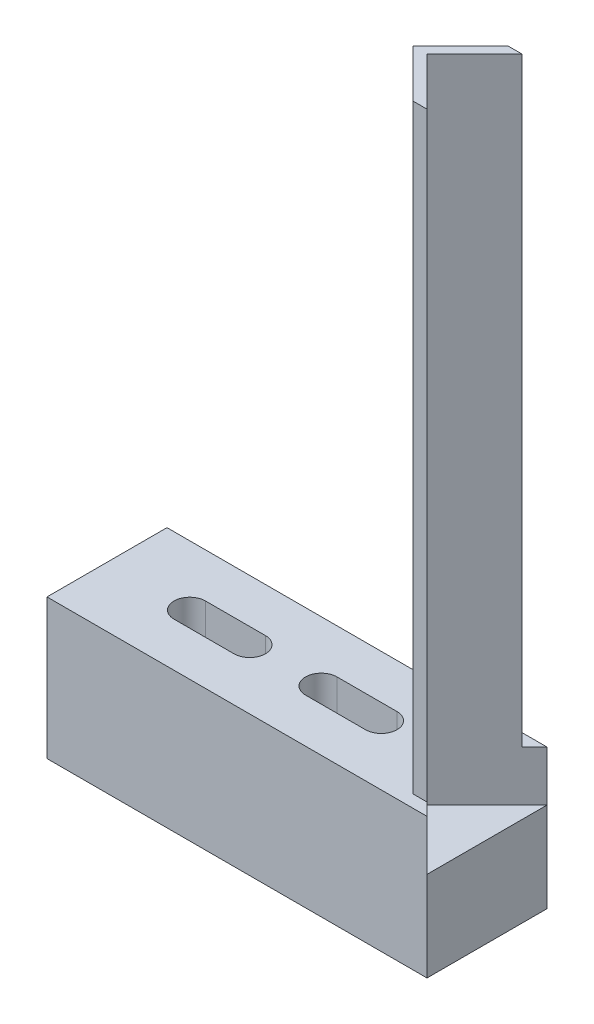
from build123d import *

# Parameters (mm, degrees)
SKETCH1_W           = 48.26
SKETCH1_H           = 17.78
BOSS_EXTRUDE1_DEPTH = 15.24
CUT_EXTRUDE1_DEPTH  = 6.37999994
CUT_EXTRUDE2_DEPTH  = 54.641528688
BOSS_EXTRUDE2_DEPTH = 76.2


with BuildPart() as part:
    # Sketch1 → Boss-Extrude1 (new body)
    with BuildSketch(Plane.XY):
        with Locations((24.13, 8.89)):
            Rectangle(SKETCH1_W, SKETCH1_H)
    extrude(amount=-BOSS_EXTRUDE1_DEPTH)

    # Sketch3 → Cut-Extrude1 (cut)
    with BuildSketch(Plane(origin=(0, 17.78, 0), x_dir=(1, 0, 0), z_dir=(0, 1, 0))):
        Polygon((48.26, 0), (48.26, 15.24), (46.685762979, 13.665762979), (40.64, 7.62), (46.685762979, 1.574237021), align=None)
    extrude(amount=-CUT_EXTRUDE1_DEPTH, mode=Mode.SUBTRACT)

    # Sketch4 → Cut-Extrude2 (cut, through all)
    with BuildSketch(Plane(origin=(0, 17.78, 0), x_dir=(1, 0, 0), z_dir=(0, 1, 0))):
        with BuildLine():
            Line((34.83, 5.62), (27.21, 5.62))
            ThreePointArc((27.21, 5.62), (25.21, 7.62), (27.21, 9.62))
            Line((27.21, 9.62), (34.83, 9.62))
            ThreePointArc((34.83, 9.62), (36.83, 7.62), (34.83, 5.62))
        make_face()
        with BuildLine():
            Line((18.13, 5.62), (10.51, 5.62))
            ThreePointArc((10.51, 5.62), (8.51, 7.62), (10.51, 9.62))
            Line((10.51, 9.62), (18.13, 9.62))
            ThreePointArc((18.13, 9.62), (20.13, 7.62), (18.13, 5.62))
        make_face()
    extrude(amount=-CUT_EXTRUDE2_DEPTH, mode=Mode.SUBTRACT)

    # Sketch3<3> → Boss-Extrude2 (add)
    with BuildSketch(Plane(origin=(0, 17.78, 0), x_dir=(1, 0, 0), z_dir=(0, 1, 0))):
        Polygon((40.64, 7.62), (46.685762979, 13.665762979), (44.889711755, 13.665762979), (38.843948776, 7.62), (44.889711755, 1.574237021), (46.685762979, 1.574237021), align=None)
    extrude(amount=BOSS_EXTRUDE2_DEPTH)


solid = part.part
